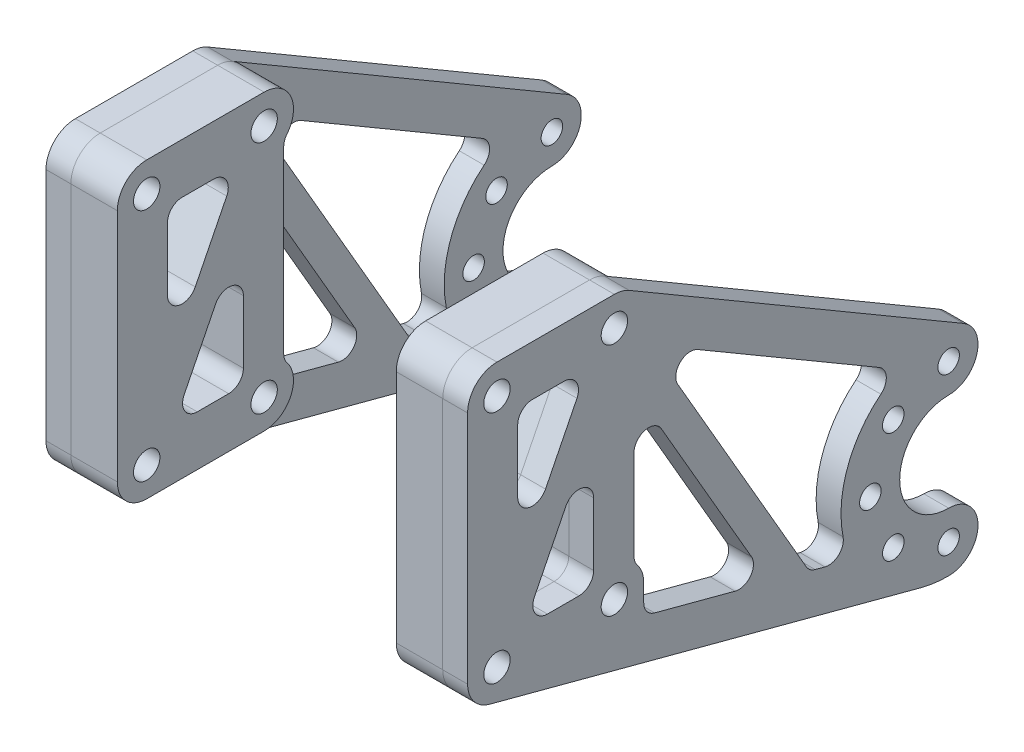
from build123d import *

# Parameters (mm, degrees)
BASE_FLANGE1_DEPTH     = 2.54
M2_5_CLEARANCE_HOLE1_D = 2.7
M2_CLEARANCE_HOLE1_D   = 2.2
SKETCH17_R             = 1.35
BOSS_EXTRUDE1_DEPTH    = 4.75
CUT_EXTRUDE1_DEPTH     = 404.966158493
CUT_EXTRUDE2_DEPTH     = 404.966158493
FILLET1_R              = 1.5
FILLET2_R              = 1.5


# Sheet-metal steps are written as plain solids
with BuildPart() as part:
    # Sketch6 → Base-Flange1 (new body)
    with BuildSketch(Plane(origin=(19, 0, 0), x_dir=(0, 0, -1), z_dir=(1, 0, 0))):
        with BuildLine():
            Line((-356.38124371, -10.630298526), (-400.480200917, 1.100827675))
            ThreePointArc((-400.480200917, 1.100827675), (-402.087381376, 2.17157144), (-402.708968249, 4))
            Line((-402.708968249, 4), (-402.708968249, 28))
            ThreePointArc((-402.708968249, 28), (-401.830288592, 30.121320344), (-399.708968249, 31))
            Line((-399.708968249, 31), (-387.708968249, 31))
            ThreePointArc((-387.708968249, 31), (-386.923629675, 30.895383105), (-386.193064223, 30.588828883))
            Line((-386.193064223, 30.588828883), (-352.037486568, 10.588828883))
            ThreePointArc((-352.037486568, 10.588828883), (-350.658007488, 7.214661426), (-353.553390593, 5))
            ThreePointArc((-353.553390593, 5), (-358.553390593, 0), (-353.553390593, -5))
            ThreePointArc((-353.553390593, -5), (-350.553390593, -8), (-353.553390593, -11))
            ThreePointArc((-353.553390593, -11), (-354.979349256, -10.907183041), (-356.38124371, -10.630298526))
        make_face()
    extrude(amount=BASE_FLANGE1_DEPTH)

    # M2.5 Clearance Hole1 (through all)
    with Locations(Plane(origin=(21.54, 0, 0), x_dir=(0, 0, -1), z_dir=(1, 0, 0))):
        with Locations((-399.708968249, 28), (-387.708968249, 28), (-387.708968249, 4), (-399.708968249, 4)):
            Hole(M2_5_CLEARANCE_HOLE1_D / 2)

    # M2 Clearance Hole1 (through all)
    with Locations(Plane(origin=(21.54, 0, 0), x_dir=(0, 0, -1), z_dir=(1, 0, 0))):
        with Locations((-353.553390593, 8), (-359.210244843, 5.656854249), (-361.553390593, 0), (-353.553390593, -8), (-359.210244843, -5.656854249)):
            Hole(M2_CLEARANCE_HOLE1_D / 2)


with BuildPart() as body_2:
    # Sketch17 → Boss-Extrude1 (new body)
    with BuildSketch(Plane.ZY.offset(-19)):
        with BuildLine():
            Line((387.708968249, 31), (399.708968249, 31))
            ThreePointArc((399.708968249, 31), (401.830288592, 30.121320344), (402.708968249, 28))
            Line((402.708968249, 28), (402.708968249, 4))
            ThreePointArc((402.708968249, 4), (401.830288592, 1.878679656), (399.708968249, 1))
            Line((399.708968249, 1), (387.708968249, 1))
            ThreePointArc((387.708968249, 1), (385.587647905, 1.878679656), (384.708968249, 4))
            Line((384.708968249, 4), (384.708968249, 28))
            ThreePointArc((384.708968249, 28), (385.587647905, 30.121320344), (387.708968249, 31))
        make_face()
        with Locations((387.708968249, 4)):
            Circle(SKETCH17_R, mode=Mode.SUBTRACT)
        with Locations((399.708968249, 4)):
            Circle(SKETCH17_R, mode=Mode.SUBTRACT)
        with Locations((399.708968249, 28)):
            Circle(SKETCH17_R, mode=Mode.SUBTRACT)
        with Locations((387.708968249, 28)):
            Circle(SKETCH17_R, mode=Mode.SUBTRACT)
    extrude(amount=BOSS_EXTRUDE1_DEPTH)


with BuildPart() as cut_extrude1_tool:
    # Sketch15 → Cut-Extrude1 (new, through all)
    with BuildSketch(Plane(origin=(21.54, 0, 0), x_dir=(0, 0, -1), z_dir=(1, 0, 0))):
        Polygon((-396.971257094, 6.121320344), (-389.830288592, 6.121320344), (-389.830288592, 20.403257347), align=None)
        with BuildLine():
            Line((-385.708968249, 21.54331737), (-385.708968249, 6.236067977))
            ThreePointArc((-385.708968249, 6.236067977), (-384.970355461, 5.224744871), (-384.708968249, 4))
            Line((-384.708968249, 4), (-384.708968249, 1.044504755))
            Line((-384.708968249, 1.044504755), (-371.886710454, -2.366449469))
            Line((-371.886710454, -2.366449469), (-385.708968249, 21.54331737))
        make_face()
        Polygon((-397.587647905, 11.596742653), (-390.446679404, 25.878679656), (-397.587647905, 25.878679656), align=None)
        with BuildLine():
            Line((-384.076965724, 24.714434352), (-367.791735007, -3.455787558))
            Line((-367.791735007, -3.455787558), (-363.55303113, -4.583360028))
            ThreePointArc((-363.55303113, -4.583360028), (-363.94829352, 3.598054077), (-358.579816843, 9.784428402))
            Line((-358.579816843, 9.784428402), (-384.076965724, 24.714434352))
        make_face()
    extrude(amount=-CUT_EXTRUDE1_DEPTH)


with BuildPart() as part_1:
    add(part.part)

    # Cut-Extrude1: cut by cut_extrude1_tool
    add(cut_extrude1_tool.part, mode=Mode.SUBTRACT)

    # Fillet1
    fillet1_edges = [part_1.edges().sort_by_distance(p)[0] for p in [
        (20.27, 11.596742653, 397.587647905),
        (20.27, 25.878679656, 397.587647905),
        (20.27, 25.878679656, 390.446679404),
        (20.27, 6.121320344, 396.971257094),
        (20.27, 20.403257347, 389.830288592),
        (20.27, 6.121320344, 389.830288592),
        (20.27, 6.236067977, 385.708968249),
        (20.27, 21.54331737, 385.708968249),
        (20.27, -2.366449469, 371.886710454),
        (20.27, 1.044504755, 384.708968249),
        (20.27, 9.784428402, 358.579816843),
        (20.27, -4.583360028, 363.55303113),
        (20.27, -3.455787558, 367.791735007),
        (20.27, 24.714434352, 384.076965724),
    ]]
    fillet(fillet1_edges, radius=FILLET1_R)


with BuildPart() as body_2_1:
    add(body_2.part)

    # Cut-Extrude1: cut by cut_extrude1_tool
    add(cut_extrude1_tool.part, mode=Mode.SUBTRACT)

    # Sketch20 → Cut-Extrude2 (cut, through all)
    with BuildSketch(Plane.ZY.offset(-14.25)):
        with BuildLine():
            Line((385.708968249, 21.54331737), (385.708968249, 25.763932023))
            ThreePointArc((385.708968249, 25.763932023), (384.970355461, 26.775255129), (384.708968249, 28))
            Line((384.708968249, 28), (384.708968249, 19.81351554))
            Line((384.708968249, 19.81351554), (385.708968249, 21.54331737))
        make_face()
    extrude(amount=-CUT_EXTRUDE2_DEPTH, mode=Mode.SUBTRACT)

    # Fillet2
    fillet2_edges = [body_2_1.edges().sort_by_distance(p)[0] for p in [
        (16.625, 25.763932023, 385.708968249),
        (16.625, 11.596742653, 397.587647905),
        (16.625, 25.878679656, 397.587647905),
        (16.625, 25.878679656, 390.446679404),
        (16.625, 6.121320344, 396.971257094),
        (16.625, 20.403257347, 389.830288592),
        (16.625, 6.121320344, 389.830288592),
        (16.625, 6.236067977, 385.708968249),
    ]]
    fillet(fillet2_edges, radius=FILLET2_R)


with BuildPart() as body_3:
    # Mirror1: mirrored copy
    add(body_2_1.part.mirror(Plane(origin=(0, 0, 0), x_dir=(0, 0, 1), z_dir=(1, 0, 0))))


with BuildPart() as body_4:
    # Mirror2: mirrored copy
    add(part_1.part.mirror(Plane(origin=(0, 0, 0), x_dir=(0, 0, 1), z_dir=(1, 0, 0))))


solid = Compound([part_1.part, body_2_1.part, body_3.part, body_4.part])
